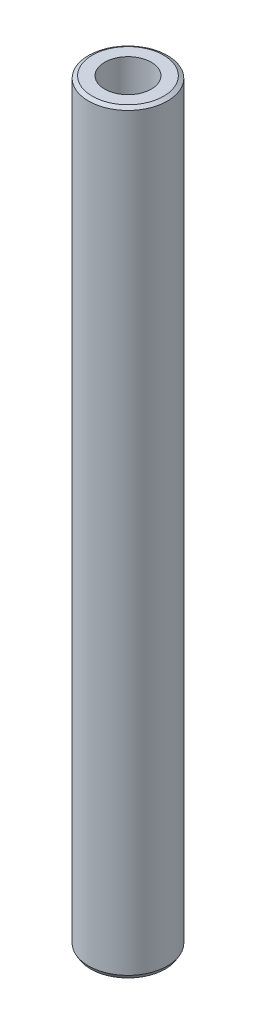
from build123d import *
from OCP.BRepFilletAPI import BRepFilletAPI_MakeChamfer

# Parameters (mm, degrees)
SKETCH1_R           = 10
BOSS_EXTRUDE1_DEPTH = 191.178711764
SKETCH2_R           = 5.903774544
CUT_EXTRUDE1_DEPTH  = 192.701068938
CHAMFER1_SIZE       = 0.563248876
CHAMFER1_SIZE2      = 0.975575671


with BuildPart() as part:
    # Sketch1 → Boss-Extrude1 (new body)
    with BuildSketch(Plane(origin=(0, 0, 0), x_dir=(1, 0, 0), z_dir=(0, 1, 0))):
        Circle(SKETCH1_R)
    extrude(amount=BOSS_EXTRUDE1_DEPTH)

    # Sketch2 → Cut-Extrude1 (cut, through all)
    with BuildSketch(Plane(origin=(0, 0, 0), x_dir=(1, 0, 0), z_dir=(0, 1, 0))):
        Circle(SKETCH2_R)
    extrude(amount=CUT_EXTRUDE1_DEPTH, mode=Mode.SUBTRACT)

    # Chamfer1: one chamfer whose edges measure the first distance from different faces: ONE call of the kernel's chamfer builder (chamfer() names one face for all edges)
    chamfer1_edges_1 = [part.edges().sort_by_distance(p)[0] for p in [
        (-10, 191.178711764, 0),
    ]]
    chamfer1_side_1 = [part.faces().sort_by_distance(p)[0] for p in [
        (-10, 95.589355882, 0),
    ]]
    chamfer1_edges_2 = [part.edges().sort_by_distance(p)[0] for p in [
        (-10, 0, 0),
    ]]
    chamfer1_side_2 = [part.faces().sort_by_distance(p)[0] for p in [
        (-9.717157288, 0, 0),
    ]]
    chamfer1 = BRepFilletAPI_MakeChamfer(part.part.solid().wrapped)
    for e in chamfer1_edges_1:
        chamfer1.Add(CHAMFER1_SIZE, CHAMFER1_SIZE2, e.wrapped, chamfer1_side_1[0].wrapped)  # the first distance lies on this face
    for e in chamfer1_edges_2:
        chamfer1.Add(CHAMFER1_SIZE, CHAMFER1_SIZE2, e.wrapped, chamfer1_side_2[0].wrapped)  # the first distance lies on this face
    add(Compound.cast(chamfer1.Shape()), mode=Mode.REPLACE)


solid = part.part
